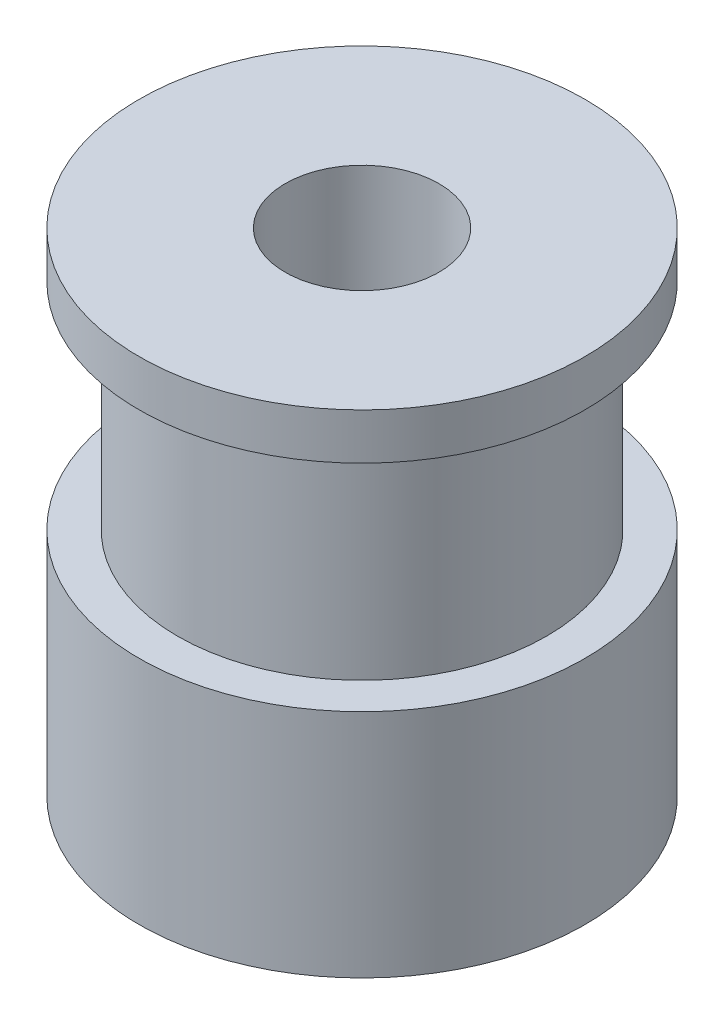
from build123d import *


with BuildPart() as part:
    # Эскиз3 → Повернуть1 (revolve)
    with BuildSketch(Plane.XY):
        Polygon((2.5, 0), (2.5, 16), (7.25, 16), (7.25, 14.5), (6, 14.5), (6, 7.5), (7.25, 7.5), (7.25, 0), align=None)
    revolve(axis=Axis((0, 0, 0), (0, 1, 0)))


solid = part.part
